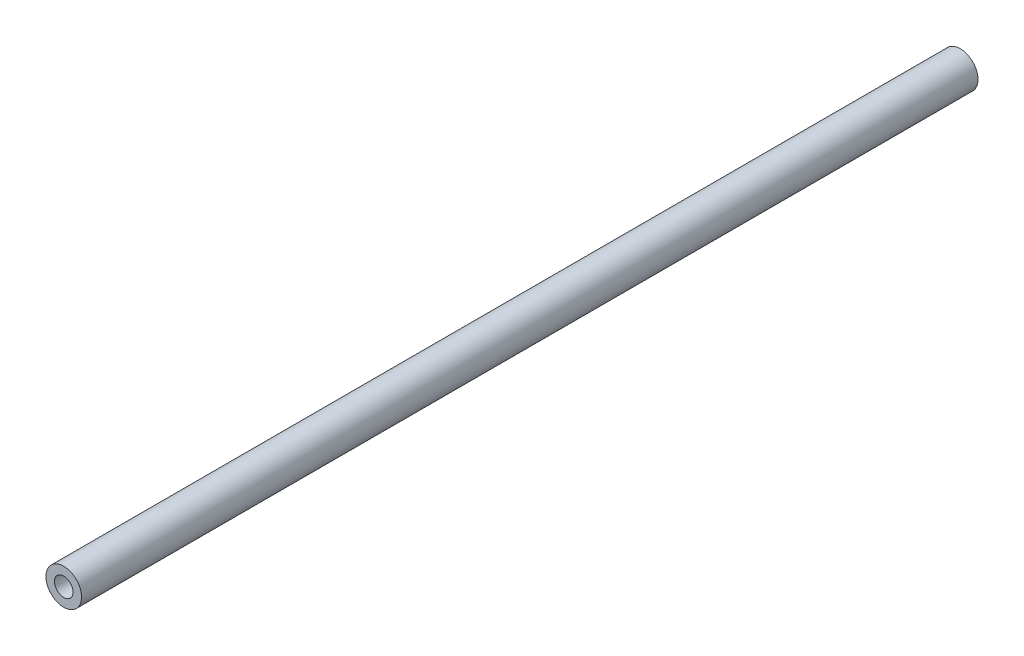
from build123d import *

# Parameters (mm, degrees)
SKETCH1_R           = 4.7625
SKETCH1_R_2         = 2.4892
BOSS_EXTRUDE1_DEPTH = 120.015


with BuildPart() as part:
    # Sketch1 → Boss-Extrude1 (new, symmetric)
    with BuildSketch(Plane.XY):
        Circle(SKETCH1_R)
        Circle(SKETCH1_R_2, mode=Mode.SUBTRACT)
    extrude(amount=BOSS_EXTRUDE1_DEPTH, both=True)


solid = part.part
